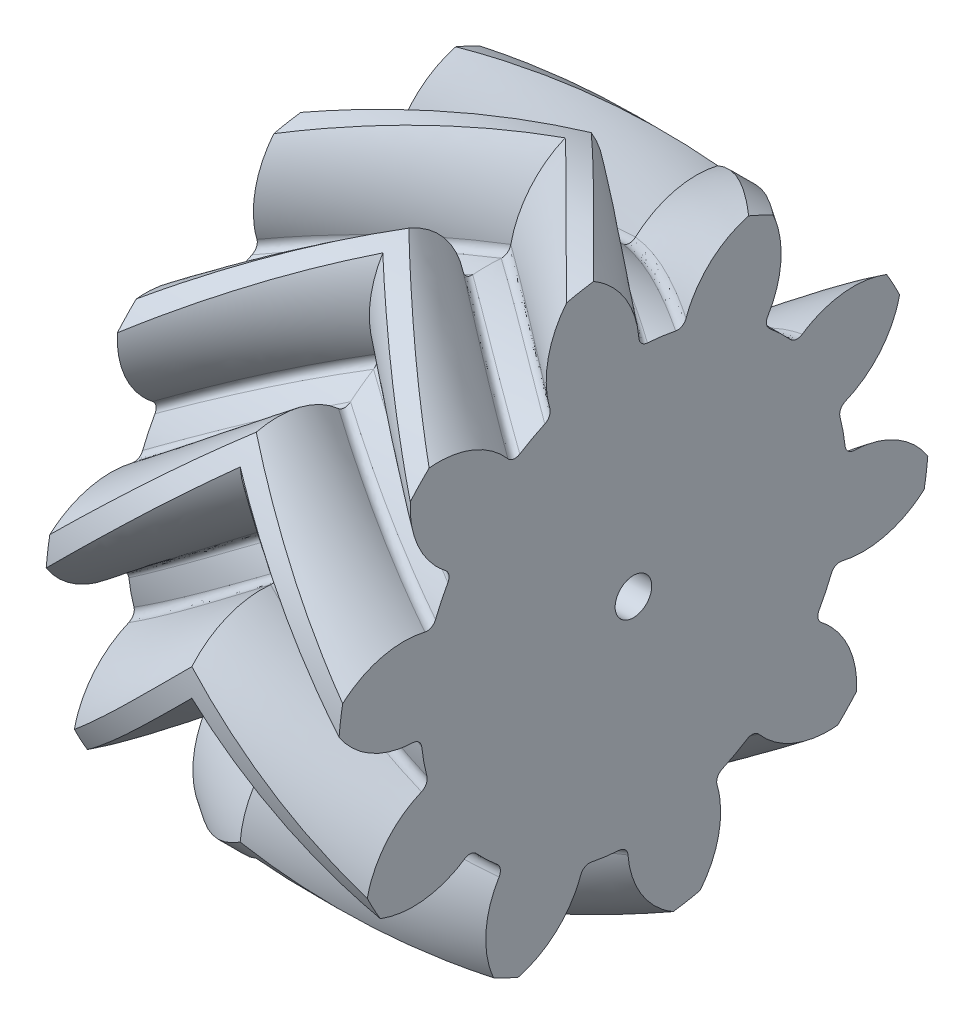
from build123d import *

# Parameters (mm, degrees)
BASPROSKE_W            = 4
BASPROSKE_H            = 8.071067812
TOOTHCUTRH_PITCH       = 50.712014689
TOOTHCUTRH_HEIGHT      = 4
TOOTHCUTRH_RADIUS      = 8.071067812
TOOTHCUTRH_START_ANGLE = -90
TEETHCUTSRH_COUNT      = 10
TEETHCUTSRH_ANGLE      = 324
BORSKE_R               = 0.5
BORE_DEPTH             = 62.5000025


with BuildPart() as part:
    # BasProSke → Base-Revolve (revolve)
    with BuildSketch(Plane(origin=(0, 0, 0), x_dir=(1, 0, 0), z_dir=(0, 1, 0)), mode=Mode.PRIVATE) as base_revolve_sk:
        with Locations((2, 4.035533906)):
            Rectangle(BASPROSKE_W, BASPROSKE_H)
    revolve(base_revolve_sk.sketch.rotate(Axis((-10, 0, 0), (1, 0, 0)), 180), axis=Axis((-10, 0, 0), (1, 0, 0)))

    # ToothCutRH: sweep along a helix
    with BuildLine() as toothcutrh_path:
        add(Helix(TOOTHCUTRH_PITCH, TOOTHCUTRH_HEIGHT, TOOTHCUTRH_RADIUS, center=(0, 0, 0), direction=(1, 0, 0), mode=Mode.PRIVATE).rotate(Axis((0, 0, 0), (1, 0, 0)), TOOTHCUTRH_START_ANGLE))
    # TooCutSkeRH → ToothCutRH (sweep, cut)
    with BuildSketch(Plane(origin=(0, 0, 0), x_dir=(0, 0, -1), z_dir=(1, 0, 0))):
        with BuildLine():
            ThreePointArc((0.388330349, 5.808100379), (0, 5.821067812), (-0.388330349, 5.808100379))
            ThreePointArc((-0.388330349, 5.808100379), (-0.555950635, 5.857948362), (-0.650334151, 6.005166342))
            ThreePointArc((-0.650334151, 6.005166342), (-1.320302926, 7.236210278), (-2.547465837, 7.913261622))
            ThreePointArc((-2.547465837, 7.913261622), (0, 8.313199846), (2.547465837, 7.913261622))
            ThreePointArc((2.547465837, 7.913261622), (1.320302926, 7.236210278), (0.650334151, 6.005166342))
            ThreePointArc((0.650334151, 6.005166342), (0.555950635, 5.857948362), (0.388330349, 5.808100379))
        make_face()
    toothcutrh = sweep(path=toothcutrh_path.line, is_frenet=True, mode=Mode.SUBTRACT)

    # TeethCutsRH: ToothCutRH ×10 about axis
    teethcutsrh_axis = Axis((-10, 0, 0), (1, 0, 0))
    for i in range(1, TEETHCUTSRH_COUNT):
        add(toothcutrh.rotate(teethcutsrh_axis, i * TEETHCUTSRH_ANGLE / (TEETHCUTSRH_COUNT - 1)), mode=Mode.SUBTRACT)

    # BorSke → Bore (cut, symmetric)
    with BuildSketch(Plane(origin=(0, 0, 0), x_dir=(0, 0, -1), z_dir=(1, 0, 0))):
        with Locations(Location((0, 0, 0), (0, 0, 180))):
            Circle(BORSKE_R)
    extrude(amount=BORE_DEPTH, both=True, mode=Mode.SUBTRACT)

    # Simetría1: part across plane


with BuildPart() as part_1:
    add(part.part)
    add(part.part.mirror(Plane(origin=(0, 0, 0), x_dir=(0, 0, 1), z_dir=(1, 0, 0))))


solid = part_1.part
